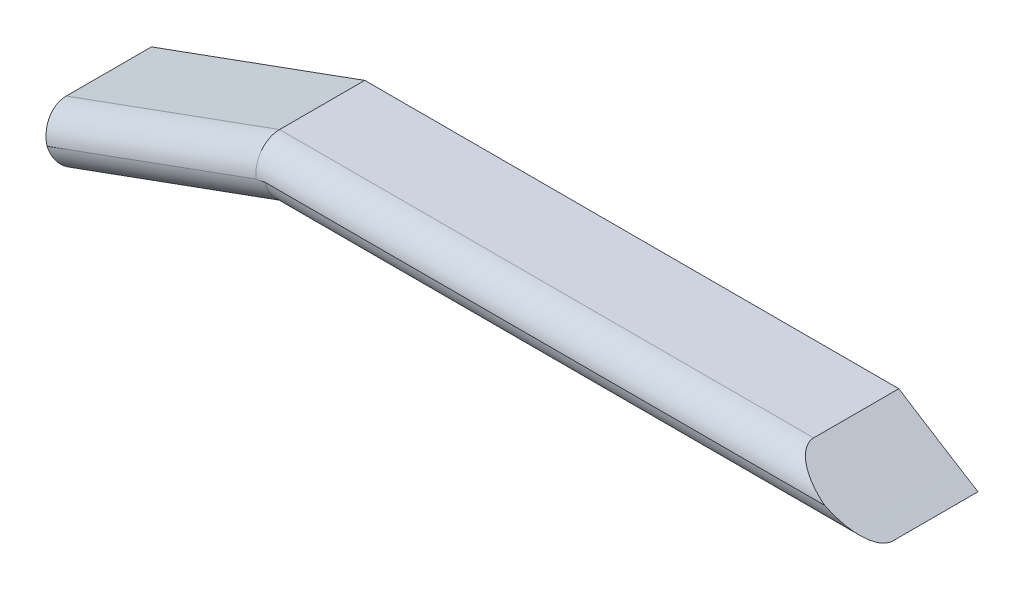
from build123d import *

# Parameters (mm, degrees)
SKETCH_1_W          = 20
SKETCH_1_H          = 4
EXTRUDE_1_DEPTH     = 1.75
EXTRUDE_2_DEPTH     = 4
EXTRUDE_3_DEPTH     = 4
CUT_EXTRUDE_1_DEPTH = 24.299797316
FILLET_4_R          = 1


with BuildPart() as part:
    # 草图1 → 凸台-拉伸1 (new body)
    with BuildSketch(Plane(origin=(0, 0, 0), x_dir=(1, 0, 0), z_dir=(0, 1, 0))):
        with Locations((10, -2)):
            Rectangle(SKETCH_1_W, SKETCH_1_H)
    extrude(amount=EXTRUDE_1_DEPTH)

    # 草图6 → 凸台-拉伸2 (add)
    with BuildSketch(Plane.XY.offset(4)):
        with BuildLine():
            Line((20, 0), (22.790216698, 0))
            ThreePointArc((22.790216698, 0), (21.391749441, 0.869644524), (20, 1.75))
            Line((20, 1.75), (20, 0))
        make_face()
    extrude(amount=-EXTRUDE_2_DEPTH)

    # 草图7 → 凸台-拉伸3 (add)
    with BuildSketch(Plane(origin=(0, 0, 0), x_dir=(-1, 0, 0), z_dir=(0, 0, -1))):
        Polygon((5.699396556, -2.736161147), (-1.818144411, 0), (-1.181196501, 1.75), (6.336344466, -0.986161147), align=None)
    extrude(amount=-EXTRUDE_3_DEPTH)

    # 草图8 → 切除-拉伸1 (cut, through all)
    with BuildSketch(Plane.XY.offset(4)):
        Polygon((1.181196501, 1.75), (-6.336344466, -0.986161147), (0, 1.75), align=None)
    extrude(amount=-CUT_EXTRUDE_1_DEPTH, mode=Mode.SUBTRACT)

    # 圆角4
    # the kernel refuses this fillet: 1 mm, written as the material it takes off along each edge
    with BuildSketch(Plane(origin=(-8.048628108, -3.591211505, 4), x_dir=(-0.3420201433256633, 0.9396926207859104, 0), z_dir=(0.9396926207859104, 0.3420201433256633, 0))) as fillet_4_piece_1_section:
        with BuildLine():
            CenterArc((FILLET_4_R, -FILLET_4_R), FILLET_4_R, 90, 90)
            Line((0, -FILLET_4_R), (0, 0))
            Line((0, 0), (FILLET_4_R, 0))
        make_face()
    fillet_4_piece_1 = extrude(amount=13, mode=Mode.PRIVATE)
    fillet_4_piece_1 = fillet_4_piece_1 - Plane(origin=(-8.048628108, 1, 3), x_dir=(0, 0, 1), z_dir=(-1, 0, 0)) * Cylinder(1, 31, mode=Mode.PRIVATE)
    add(fillet_4_piece_1, mode=Mode.SUBTRACT)
    with BuildSketch(Plane(origin=(-0.681855589, 0, 4), x_dir=(0, 1, 0), z_dir=(1, 0, 0))) as fillet_4_piece_2_section:
        with BuildLine():
            CenterArc((FILLET_4_R, -FILLET_4_R), FILLET_4_R, 90, 90)
            Line((0, -FILLET_4_R), (0, 0))
            Line((0, 0), (FILLET_4_R, 0))
        make_face()
    fillet_4_piece_2 = extrude(amount=25.972072288, mode=Mode.PRIVATE)
    fillet_4_piece_2 = fillet_4_piece_2 - Plane(origin=(-0.731431287, 0.136208109, 3), x_dir=(0, 0, 1), z_dir=(-0.9396926207859104, -0.3420201433256633, 0)) * Cylinder(1, 56, mode=Mode.PRIVATE)
    add(fillet_4_piece_2, mode=Mode.SUBTRACT)
    with BuildSketch(Plane(origin=(5.174890139, 3.203585609, 4), x_dir=(0.34202014332566305, -0.9396926207859104, 0), z_dir=(-0.9396926207859105, -0.3420201433256631, 0))) as fillet_4_piece_3:
        with BuildLine():
            CenterArc((FILLET_4_R, -FILLET_4_R), FILLET_4_R, 90, 90)
            Line((0, -FILLET_4_R), (0, 0))
            Line((0, 0), (FILLET_4_R, 0))
        make_face()
    extrude(amount=14.75, mode=Mode.SUBTRACT)
    with BuildSketch(Plane(origin=(22.5, 1.75, 4), x_dir=(0, -1, 0), z_dir=(-1, 0, 0))) as fillet_4_piece_4:
        with BuildLine():
            CenterArc((FILLET_4_R, -FILLET_4_R), FILLET_4_R, 90, 90)
            Line((0, -FILLET_4_R), (0, 0))
            Line((0, 0), (FILLET_4_R, 0))
        make_face()
    extrude(amount=25.568803499, mode=Mode.SUBTRACT)


solid = part.part
